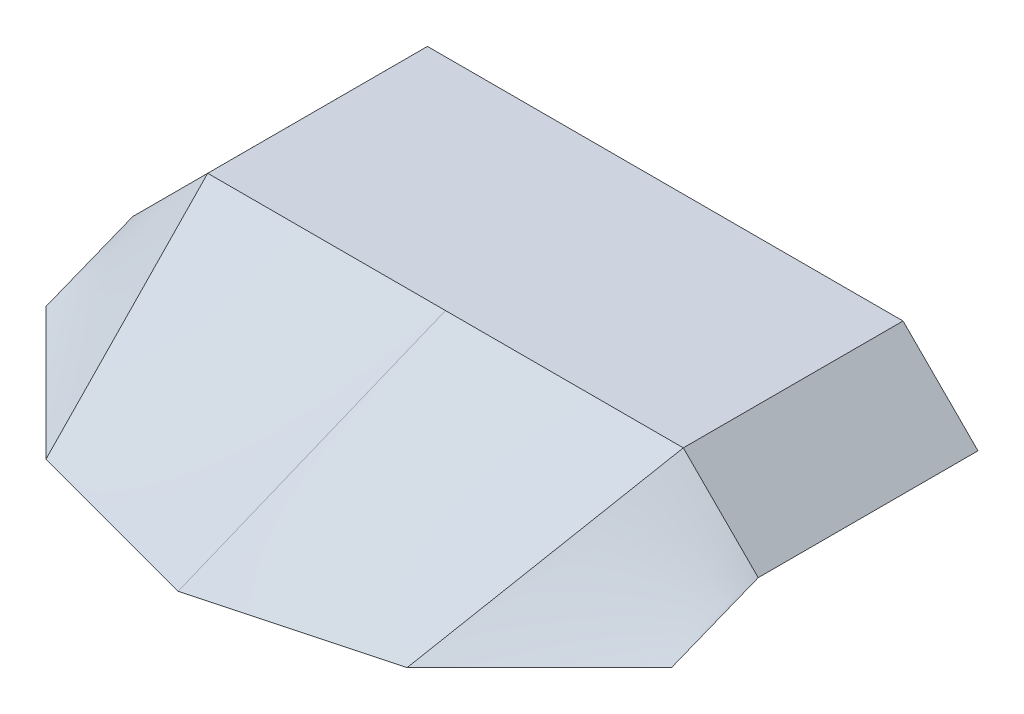
from build123d import *

# Parameters (mm, degrees)
BOSS_EXTRUDE1_DEPTH = 70.26


with BuildPart() as part:
    # Loft13: read off the stored shape, not the designer's step
    # Loft13: loft between two sections, ruled curve by curve
    loft13_from = [
        Edge.make_bspline([(-100.000171146, 11.035604797, 30), (-99.166809288, 10.690415013, 30), (-98.33344743, 10.345225229, 30), (-96.666723715, 9.654845662, 30), (-95.833361858, 9.309655878, 30), (-95, 8.964466094, 30)], [0, 0, 0, 0, 0.5, 0.5, 1, 1, 1, 1], 3),
        Edge.make_bspline([(-95, 8.964466094, 30), (-94.590223449, 9.374207863, 30), (-94.180446899, 9.783949632, 30), (-93.360893797, 10.603433171, 30), (-92.951117247, 11.01317494, 30), (-92.541340696, 11.422916709, 30)], [0, 0, 0, 0, 0.5, 0.5, 1, 1, 1, 1], 3),
        Edge.make_bspline([(-76.034367882, 34.999373863, 30), (-80.028668426, 31.005412352, 30), (-84.02296897, 27.011450841, 30), (-92.011570058, 19.023527819, 30), (-96.005870602, 15.029566308, 30), (-100.000171146, 11.035604797, 30)], [0, 0, 0, 0, 0.5, 0.5, 1, 1, 1, 1], 3),
        Edge.make_bspline([(-92.541340696, 11.422916709, 30), (-89.444897324, 14.519097257, 30), (-86.348453952, 17.615277806, 30), (-80.155567208, 23.807638903, 30), (-77.059123835, 26.903819451, 30), (-73.962680463, 30, 30)], [0, 0, 0, 0, 0.5, 0.5, 1, 1, 1, 1], 3),
        Edge.make_bspline([(-73.962680463, 30, 30), (-49.307680463, 30, 30), (-24.652680463, 30, 30), (24.657319537, 30, 30), (49.312319537, 30, 30), (73.967319537, 30, 30)], [0, 0, 0, 0, 0.5, 0.5, 1, 1, 1, 1], 3),
        Edge.make_bspline([(73.967319537, 30, 30), (77.473093055, 26.493928889, 30), (80.978866573, 22.987857778, 30), (87.99041361, 15.975715557, 30), (91.496187128, 12.469644446, 30), (95.001960646, 8.963573335, 30)], [0, 0, 0, 0, 0.5, 0.5, 1, 1, 1, 1], 3),
        Edge.make_bspline([(95.001960646, 8.963573335, 30), (95.834992025, 9.30862623, 30), (96.668023403, 9.653679125, 30), (98.33408616, 10.343784915, 30), (99.167117539, 10.68883781, 30), (100.000148917, 11.033890705, 30)], [0, 0, 0, 0, 0.5, 0.5, 1, 1, 1, 1], 3),
        Edge.make_bspline([(100.000148917, 11.033890705, 30), (96.006240753, 15.028137898, 30), (92.012332588, 19.022385091, 30), (84.024516259, 27.010879477, 30), (80.030608095, 31.00512667, 30), (76.03669993, 34.999373863, 30)], [0, 0, 0, 0, 0.5, 0.5, 1, 1, 1, 1], 3),
        Edge.make_bspline([(76.03669993, 34.999373863, 30), (63.364110946, 34.999373863, 30), (50.691521962, 34.999373863, 30), (25.346343993, 34.999373863, 30), (12.673755009, 34.999373863, 30), (0.001166024, 34.999373863, 30)], [0, 0, 0, 0, 0.5, 0.5, 1, 1, 1, 1], 3),
        Edge.make_bspline([(0.001166024, 34.999373863, 30), (-12.67142296, 34.999373863, 30), (-25.344011944, 34.999373863, 30), (-50.689189913, 34.999373863, 30), (-63.361778897, 34.999373863, 30), (-76.034367882, 34.999373863, 30)], [0, 0, 0, 0, 0.5, 0.5, 1, 1, 1, 1], 3),
    ]
    loft13_to = [
        Edge.make_bspline([(-100, 0, 57.735026919), (-98.821488698, 0, 57.735026919), (-97.642977396, 0, 57.735026919), (-95.285954792, 0, 57.735026919), (-94.10744349, 0, 57.735026919), (-92.928932188, 0, 57.735026919)], [0, 0, 0, 0, 0.5, 0.5, 1, 1, 1, 1], 3),
        Edge.make_bspline([(-92.928932188, 0, 57.735026919), (-86.631916235, 0, 64.032042873), (-80.334900281, 0, 70.329058826), (-67.740868375, 0, 82.923090733), (-61.443852421, 0, 89.220106686), (-55.146836468, 0, 95.517122639)], [0, 0, 0, 0, 0.5, 0.5, 1, 1, 1, 1], 3),
        Edge.make_bspline([(-57.735026919, 0, 100), (-64.779189099, 0, 92.95583782), (-71.823351279, 0, 85.91167564), (-85.91167564, 0, 71.82335128), (-92.95583782, 0, 64.7791891), (-100, 0, 57.735026919)], [0, 0, 0, 0, 0.5, 0.5, 1, 1, 1, 1], 3),
        Edge.make_bspline([(-55.146836468, 0, 95.517122639), (-45.955697057, 0, 97.979881022), (-36.764557645, 0, 100.442639405), (-18.382278823, 0, 105.368156171), (-9.191139411, 0, 107.830914553), (0, 0, 110.293672936)], [0, 0, 0, 0, 0.5, 0.5, 1, 1, 1, 1], 3),
        Edge.make_bspline([(0, 0, 110.293672936), (9.191139411, 0, 107.830914553), (18.382278823, 0, 105.368156171), (36.764557645, 0, 100.442639405), (45.955697057, 0, 97.979881022), (55.146836468, 0, 95.517122639)], [0, 0, 0, 0, 0.5, 0.5, 1, 1, 1, 1], 3),
        Edge.make_bspline([(55.146836468, 0, 95.517122639), (61.443852421, 0, 89.220106686), (67.740868375, 0, 82.923090733), (80.334900281, 0, 70.329058826), (86.631916235, 0, 64.032042873), (92.928932188, 0, 57.735026919)], [0, 0, 0, 0, 0.5, 0.5, 1, 1, 1, 1], 3),
        Edge.make_bspline([(92.928932188, 0, 57.735026919), (94.10744349, 0, 57.735026919), (95.285954792, 0, 57.735026919), (97.642977396, 0, 57.735026919), (98.821488698, 0, 57.735026919), (100, 0, 57.735026919)], [0, 0, 0, 0, 0.5, 0.5, 1, 1, 1, 1], 3),
        Edge.make_bspline([(100, 0, 57.735026919), (92.95583782, 0, 64.7791891), (85.91167564, 0, 71.82335128), (71.823351279, 0, 85.91167564), (64.779189099, 0, 92.95583782), (57.735026919, 0, 100)], [0, 0, 0, 0, 0.5, 0.5, 1, 1, 1, 1], 3),
        Edge.make_bspline([(57.735026919, 0, 100), (48.112522433, 0, 102.578342307), (38.490017946, 0, 105.156684613), (19.245008973, 0, 110.313369226), (9.622504487, 0, 112.891711532), (0, 0, 115.470053838)], [0, 0, 0, 0, 0.5, 0.5, 1, 1, 1, 1], 3),
        Edge.make_bspline([(0, 0, 115.470053838), (-9.622504487, 0, 112.891711532), (-19.245008973, 0, 110.313369226), (-38.490017946, 0, 105.156684613), (-48.112522433, 0, 102.578342307), (-57.735026919, 0, 100)], [0, 0, 0, 0, 0.5, 0.5, 1, 1, 1, 1], 3),
    ]
    loft13 = Solid(Shell([*[Face.make_surface_from_curves(loft13_from[k], loft13_to[k]) for k in range(10)], Face(Wire(loft13_from)), Face(Wire(loft13_to))]))
    add(loft13)

    # Sketch9 → Boss-Extrude1 (add)
    with BuildSketch(Plane.XY.offset(30)):
        Polygon((100.000148917, 11.033890705), (95.001960646, 8.963573335), (73.967319537, 30), (-73.962680463, 30), (-95, 8.964466094), (-100.000171146, 11.035604797), (-76.034367882, 34.999373863), (76.03669993, 34.999373863), align=None)
    extrude(amount=-BOSS_EXTRUDE1_DEPTH)


solid = part.part
